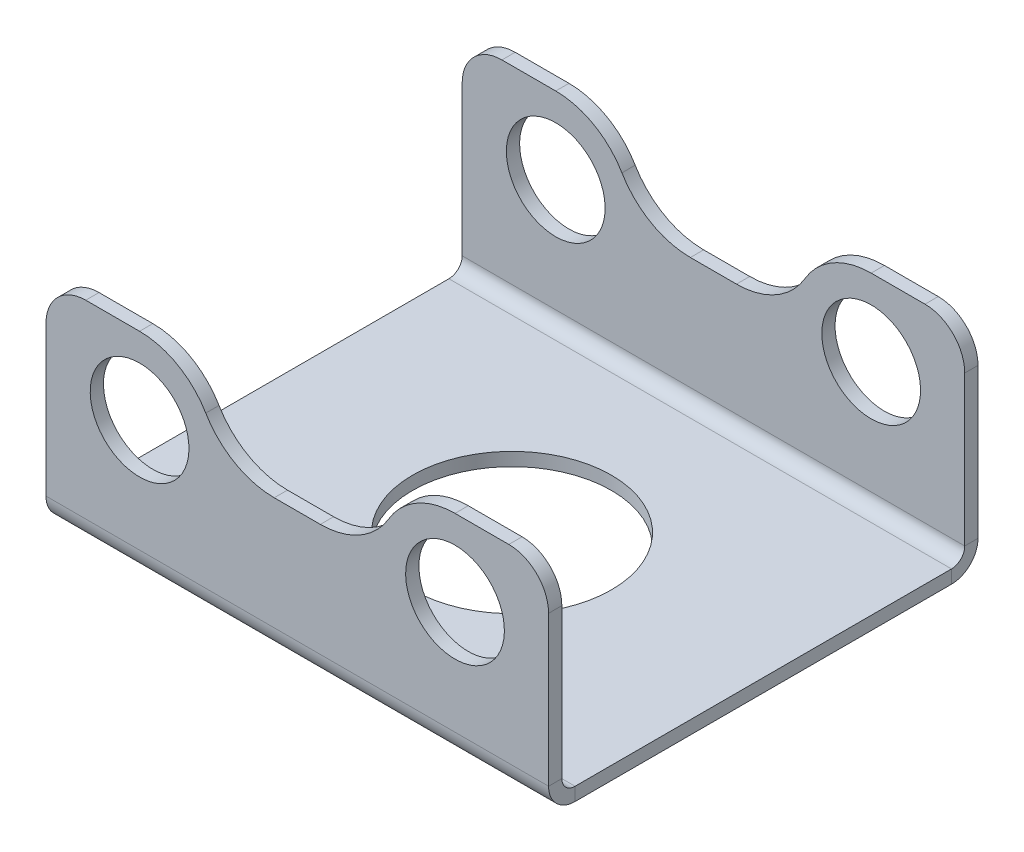
from build123d import *

# Parameters (mm, degrees)
SKETCH1_W               = 48.1584
SKETCH1_H               = 36.068
SKETCH1_R               = 9.525
BASE_FLANGE1_DEPTH      = 1.27
EDGE_FLANGE1_DEPTH      = 48.1584
EDGE_FLANGE1_START      = 1.27
EDGE_FLANGE1_PROFILE_W  = 48.1584
EDGE_FLANGE1_PROFILE_H  = 19.7612
EDGE_FLANGE1_PROFILE_R  = 4.73075
EDGE_FLANGE1_FLAT_DEPTH = 1.27
CUT_EXTRUDE7_DEPTH      = 53.108321313
FILLET2_R               = 7.62
FILLET3_R               = 3.81


# Sheet-metal steps are written as plain solids
with BuildPart() as part:
    # Sketch1 → Base-Flange1 (new body)
    with BuildSketch(Plane(origin=(0, 0, 0), x_dir=(1, 0, 0), z_dir=(0, 1, 0))):
        Rectangle(SKETCH1_W, SKETCH1_H)
        with Locations(Location((0, 0, 0), (0, 0, 270))):
            Circle(SKETCH1_R, mode=Mode.SUBTRACT)
    extrude(amount=-BASE_FLANGE1_DEPTH)

    # Edge-Flange1 bend section (across the edge) → Edge-Flange1 (add)
    with BuildSketch(Plane(origin=(24.0792, 0, -19.304), x_dir=(0, 0, 1), z_dir=(-1, 0, 0))):
        with BuildLine():
            Line((-1.27, 1.27), (0, 1.27))
            ThreePointArc((0, 1.27), (0.371974388, 0.371974388), (1.27, 0))
            Line((1.27, 0), (1.27, -1.27))
            ThreePointArc((1.27, -1.27), (-0.526051224, -0.526051224), (-1.27, 1.27))
        make_face()
    edge_flange1 = extrude(amount=EDGE_FLANGE1_DEPTH)

    # Edge-Flange1 profile (on flange) → Edge-Flange1 flat (add)
    with BuildSketch(Plane(origin=(0, 0, -19.304), x_dir=(-1, 0, 0), z_dir=(0, 0, -1)).offset(EDGE_FLANGE1_START)):
        with Locations((0, 11.1506)):
            Rectangle(EDGE_FLANGE1_PROFILE_W, EDGE_FLANGE1_PROFILE_H)
        with Locations((-15.113, 12.065)):
            Circle(EDGE_FLANGE1_PROFILE_R, mode=Mode.SUBTRACT)
        with Locations((15.113, 12.065)):
            Circle(EDGE_FLANGE1_PROFILE_R, mode=Mode.SUBTRACT)
    edge_flange1_flat = extrude(amount=-EDGE_FLANGE1_FLAT_DEPTH)

    # Mirror1: Edge-Flange1, Edge-Flange1 flat across plane
    add(edge_flange1.mirror(Plane.XY))
    add(edge_flange1_flat.mirror(Plane.XY))

    # Sketch11 → Cut-Extrude7 (cut, through all)
    with BuildSketch(Plane(origin=(0, 0, -20.574), x_dir=(-1, 0, 0), z_dir=(0, 0, -1))):
        with BuildLine():
            Line((24.0792, 19.431), (24.0792, 21.0312))
            Line((24.0792, 21.0312), (-24.0792, 21.0312))
            Line((-24.0792, 21.0312), (-24.0792, 19.431))
            Line((-24.0792, 19.431), (-15.113, 19.431))
            ThreePointArc((-15.113, 19.431), (-9.90445145, 17.27354855), (-7.747, 12.065))
            Line((-7.747, 12.065), (7.747, 12.065))
            ThreePointArc((7.747, 12.065), (9.90445145, 17.27354855), (15.113, 19.431))
            Line((15.113, 19.431), (24.0792, 19.431))
        make_face()
    extrude(amount=-CUT_EXTRUDE7_DEPTH, mode=Mode.SUBTRACT)

    # Fillet2
    fillet2_edges = [part.edges().sort_by_distance(p)[0] for p in [
        (7.747, 12.065, -19.939),
        (-7.747, 12.065, -19.939),
        (7.747, 12.065, 19.939),
        (-7.747, 12.065, 19.939),
    ]]
    fillet(fillet2_edges, radius=FILLET2_R)

    # Fillet3
    fillet3_edges = [part.edges().sort_by_distance(p)[0] for p in [
        (-24.0792, 19.431, -19.939),
        (24.0792, 19.431, -19.939),
        (24.0792, 19.431, 19.939),
        (-24.0792, 19.431, 19.939),
    ]]
    fillet(fillet3_edges, radius=FILLET3_R)


solid = part.part
